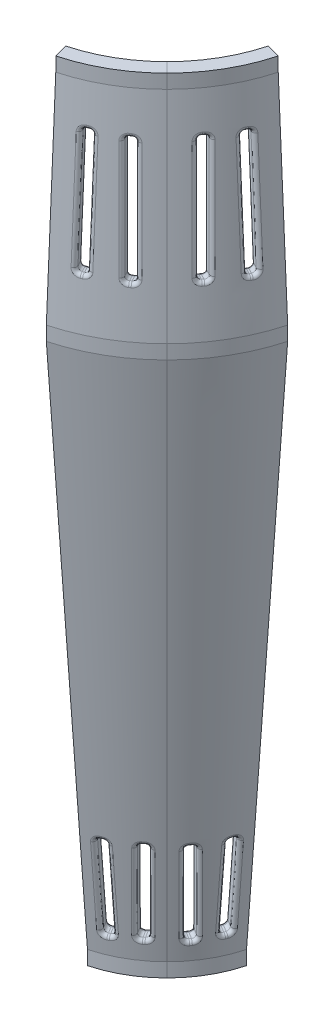
from build123d import *

# Parameters (mm, degrees)
BOSS_EXTRUDE1_DEPTH     = 5
BOSS_EXTRUDE2_DEPTH     = 5
BOSS_EXTRUDE3_DEPTH     = 5
CUT_EXTRUDE3_DEPTH      = 3
CUT_EXTRUDE3_DEPTH_BACK = 3
CUT_EXTRUDE4_DEPTH      = 288.923481945
CUT_EXTRUDE4_DEPTH_BACK = 288.923481945
CUT_EXTRUDE5_DEPTH      = 296.67991099
CUT_EXTRUDE5_DEPTH_BACK = 296.67991099
FILLET1_R               = 1.27
CIRPATTERN8_COUNT       = 2
CIRPATTERN8_ANGLE       = 330


with BuildPart() as part:
    # Sketch2 → Boss-Extrude1 (new body)
    with BuildSketch(Plane(origin=(0, 210.000000116, 0), x_dir=(1, 0, 0), z_dir=(0, 1, 0))):
        with BuildLine():
            Line((14.416220812, -53.802068524), (15.710316038, -58.631697656))
            ThreePointArc((15.710316038, -58.631697656), (30.35, -52.56774201), (42.921381618, -42.921381618))
            Line((42.921381618, -42.921381618), (39.385847712, -39.385847712))
            ThreePointArc((39.385847712, -39.385847712), (27.85, -48.237614991), (14.416220812, -53.802068524))
        make_face()
    extrude(amount=-BOSS_EXTRUDE1_DEPTH)


with BuildPart() as body_2:
    # Sketch1 → Boss-Extrude2 (new body)
    with BuildSketch(Plane(origin=(0, 0, 0), x_dir=(1, 0, 0), z_dir=(0, 1, 0))):
        with BuildLine():
            Line((9.058666579, -33.80740392), (10.352761804, -38.637033052))
            ThreePointArc((10.352761804, -38.637033052), (20, -34.641016151), (28.284271247, -28.284271247))
            Line((28.284271247, -28.284271247), (24.748737342, -24.748737342))
            ThreePointArc((24.748737342, -24.748737342), (17.5, -30.310889132), (9.058666579, -33.80740392))
        make_face()
    extrude(amount=BOSS_EXTRUDE2_DEPTH)


    add(part.part)  # loft4 joins it to this body
    # loft from a face of the part (loft4)
    loft([body_2.faces().sort_by_distance((18.564010231, 5, 32.153808912))[0], body_2.faces().sort_by_distance((28.786417847, 205.000000116, 49.85953828))[0]])



with BuildPart() as body_2_2:
    # Sketch3 → Boss-Extrude3 (new body)
    with BuildSketch(Plane(origin=(0, 290.000000116, 0), x_dir=(1, 0, 0), z_dir=(0, 1, 0))):
        with BuildLine():
            Line((13.186830348, -49.213920849), (14.480925573, -54.043549981))
            ThreePointArc((14.480925573, -54.043549981), (27.975, -48.454121342), (39.562624407, -39.562624407))
            Line((39.562624407, -39.562624407), (36.027090501, -36.027090501))
            ThreePointArc((36.027090501, -36.027090501), (25.475, -44.123994323), (13.186830348, -49.213920849))
        make_face()
    extrude(amount=-BOSS_EXTRUDE3_DEPTH)


with BuildPart() as body_2_1:
    add(body_2.part)

    add(body_2_2.part)  # loft6 joins it to this body
    # loft from a face of the part (loft6)
    loft([body_2_1.faces().sort_by_distance((28.786417847, 210.000000116, 49.85953828))[0], body_2_1.faces().sort_by_distance((26.440027474, 285.000000116, 45.795470938))[0]])

    # Sketch9 → Cut-Extrude3 (cut, two sides: drawn at the far end of the back side and taken through both)
    with BuildSketch(Plane(origin=(17.354016575, -3.183330816, 30.058038424), x_dir=(-0.8672192778226417, -0.047822361107098296, 0.49562460184187573), z_dir=(-0.497910155053203, 0.09133405706300789, -0.8624056861566409)).offset(-CUT_EXTRUDE3_DEPTH_BACK)):
        with BuildLine():
            Line((-3.638294843, 185.860615215), (9.061705157, 186.471212857))
            Line((9.061705157, 186.471212857), (9.205774406, 183.474674179))
            Line((9.205774406, 183.474674179), (-3.494225594, 182.864076537))
            ThreePointArc((-3.494225594, 182.864076537), (-8.587530688, 178.614577364), (-14.065020444, 182.355848001))
            Line((-14.065020444, 182.355848001), (-26.765020444, 181.745250359))
            Line((-26.765020444, 181.745250359), (-26.909089692, 184.741789037))
            Line((-26.909089692, 184.741789037), (-14.209089692, 185.352386679))
            ThreePointArc((-14.209089692, 185.352386679), (-9.115784598, 189.601885852), (-3.638294843, 185.860615215))
        make_face()
        with BuildLine():
            Line((-12.144097319, 142.40200275), (-24.844097319, 141.791405108))
            Line((-24.844097319, 141.791405108), (-24.988166567, 144.787943786))
            Line((-24.988166567, 144.787943786), (-12.288166567, 145.398541428))
            ThreePointArc((-12.288166567, 145.398541428), (-7.194861473, 149.648040601), (-1.717371717, 145.906769964))
            Line((-1.717371717, 145.906769964), (10.982628283, 146.517367606))
            Line((10.982628283, 146.517367606), (11.126697531, 143.520828928))
            Line((11.126697531, 143.520828928), (-1.573302469, 142.910231286))
            ThreePointArc((-1.573302469, 142.910231286), (-6.666607563, 138.660732113), (-12.144097319, 142.40200275))
        make_face()
        with BuildLine():
            Line((-10.223174193, 102.448157499), (-22.923174193, 101.837559857))
            Line((-22.923174193, 101.837559857), (-23.067243441, 104.834098535))
            Line((-23.067243441, 104.834098535), (-10.367243441, 105.444696177))
            ThreePointArc((-10.367243441, 105.444696177), (-5.273938347, 109.69419535), (0.203551409, 105.952924713))
            Line((0.203551409, 105.952924713), (12.903551409, 106.563522355))
            Line((12.903551409, 106.563522355), (13.047620657, 103.566983677))
            Line((13.047620657, 103.566983677), (0.347620657, 102.956386035))
            ThreePointArc((0.347620657, 102.956386035), (-4.745684437, 98.706886862), (-10.223174193, 102.448157499))
        make_face()
        with BuildLine():
            Line((-8.302251068, 62.494312248), (-21.002251068, 61.883714606))
            Line((-21.002251068, 61.883714606), (-21.146320316, 64.880253284))
            Line((-21.146320316, 64.880253284), (-8.446320316, 65.490850926))
            ThreePointArc((-8.446320316, 65.490850926), (-3.353015222, 69.740350099), (2.124474534, 65.999079462))
            Line((2.124474534, 65.999079462), (14.824474534, 66.609677104))
            Line((14.824474534, 66.609677104), (14.968543782, 63.613138425))
            Line((14.968543782, 63.613138425), (2.268543782, 63.002540784))
            ThreePointArc((2.268543782, 63.002540784), (-2.824761312, 58.753041611), (-8.302251068, 62.494312248))
        make_face()
    extrude(amount=CUT_EXTRUDE3_DEPTH + CUT_EXTRUDE3_DEPTH_BACK, mode=Mode.SUBTRACT)

    # Sketch10 → Cut-Extrude4 (cut, two sides: drawn at the far end of the back side and taken through both)
    with BuildSketch(Plane(origin=(36.125514466, 5.857823654, 62.571226504), x_dir=(0.8669302148879233, -0.03722067846270204, -0.49703784927222144), z_dir=(0.4983647284523202, 0.08081082686487642, 0.8631930303796829)).offset(-CUT_EXTRUDE4_DEPTH_BACK)):
        Polygon((-2.803876205, 264.819761964), (-0.494477777, 221.867193057), (-3.669477777, 221.867193057), (-5.978876205, 264.819761964), align=None)
        Polygon((-13.80448772, 264.819761964), (-16.97948772, 264.819761964), (-16.077847001, 221.867193057), (-12.902847001, 221.867193057), align=None)
    extrude(amount=CUT_EXTRUDE4_DEPTH + CUT_EXTRUDE4_DEPTH_BACK, mode=Mode.SUBTRACT)

    # Sketch11 → Cut-Extrude5 (cut, two sides: drawn at the far end of the back side and taken through both)
    with BuildSketch(Plane(origin=(17.354016575, -3.183330816, 30.058038424), x_dir=(-0.8672192778226417, -0.047822361107098296, 0.49562460184187573), z_dir=(-0.497910155053203, 0.09133405706300789, -0.8624056861566409)).offset(-CUT_EXTRUDE5_DEPTH_BACK)):
        Polygon((-9.183548892, 46.802081139), (-6.813770468, 15.133356793), (-3.638770468, 15.133356793), (-6.008548892, 46.802081139), align=None)
        Polygon((1.488708671, 46.883356793), (2.16801084, 15.133356793), (5.34301084, 15.133356793), (4.663708671, 46.883356793), align=None)
    extrude(amount=CUT_EXTRUDE5_DEPTH + CUT_EXTRUDE5_DEPTH_BACK, mode=Mode.SUBTRACT)

    # Fillet1
    fillet1_edges = [body_2_1.edges().sort_by_distance(p)[0] for p in [
        (32.735887556, 248.861477538, 48.167586173),
        (35.014661108, 227.323945628, 48.233487082),
        (35.327907608, 248.71728412, 46.311525793),
        (33.074129695, 270.258104449, 46.280146588),
        (25.344521371, 249.179454775, 52.412447414),
        (23.537613358, 270.668359182, 51.756888069),
        (22.433753797, 249.271972492, 53.716420892),
        (24.258130181, 227.786687147, 54.410901413),
        (21.755768252, 227.381000002, 50.077535414),
        (24.460070928, 227.536791422, 51.583491745),
        (19.924187386, 248.865041801, 49.369724346),
        (21.535890446, 227.627129303, 52.864233545),
        (21.037224897, 270.26299379, 47.426959903),
        (20.821785211, 270.509852203, 50.221451452),
        (22.850026953, 248.774967359, 48.09185635),
        (23.733924547, 270.417561827, 48.919853778),
        (30.574470366, 269.852701853, 41.949734059),
        (30.515325537, 270.125823813, 45.025278317),
        (32.81831438, 248.310349084, 41.964782831),
        (33.105970986, 269.981402567, 43.166836894),
        (32.513008772, 226.918221677, 43.899642974),
        (35.039985029, 227.046197831, 45.109011386),
        (30.241367241, 248.456985924, 43.846950239),
        (32.461375476, 227.192570722, 46.988299593),
        (23.979514206, 27.424897989, 34.871879612),
        (24.117662878, 11.721891908, 32.779255982),
        (26.550078293, 27.610283429, 32.981553305),
        (26.446827339, 43.30832093, 35.120916015),
        (15.272087482, 27.02938567, 39.425439072),
        (16.320777403, 11.292363762, 37.231131275),
        (18.209861386, 27.147397907, 38.171138822),
        (17.184190096, 42.878775372, 40.419176443),
        (14.444048517, 43.053683136, 38.837448152),
        (14.686197429, 43.336794577, 36.094453599),
        (17.402800157, 43.167854382, 37.619482784),
        (15.724787677, 27.603247048, 33.866864904),
        (16.530814921, 11.583000612, 34.416731115),
        (13.826171352, 11.749747345, 32.912413245),
        (13.589949363, 11.465548435, 35.665676088),
        (12.762225246, 27.48978265, 35.078230206),
        (23.905217161, 43.445369001, 33.896978345),
        (23.950425016, 43.766445864, 30.795110177),
        (26.454841797, 43.634588384, 31.970384218),
        (24.040156053, 28.070691421, 28.634240415),
        (24.135079349, 12.046449435, 29.644866731),
        (21.624764576, 12.179388392, 28.459381125),
        (21.567640492, 11.860497801, 31.540605722),
        (21.494371917, 27.880759717, 30.567486898),
    ]]
    fillet(fillet1_edges, radius=FILLET1_R)


with BuildPart() as cirpattern8_1:
    # CirPattern8: pattern copy
    add(body_2_1.part.rotate(Axis((0, 290.000000116, 0), (0, -1, 0)), 1 * CIRPATTERN8_ANGLE / (CIRPATTERN8_COUNT - 1)))


solid = Compound([body_2_1.part, cirpattern8_1.part])
